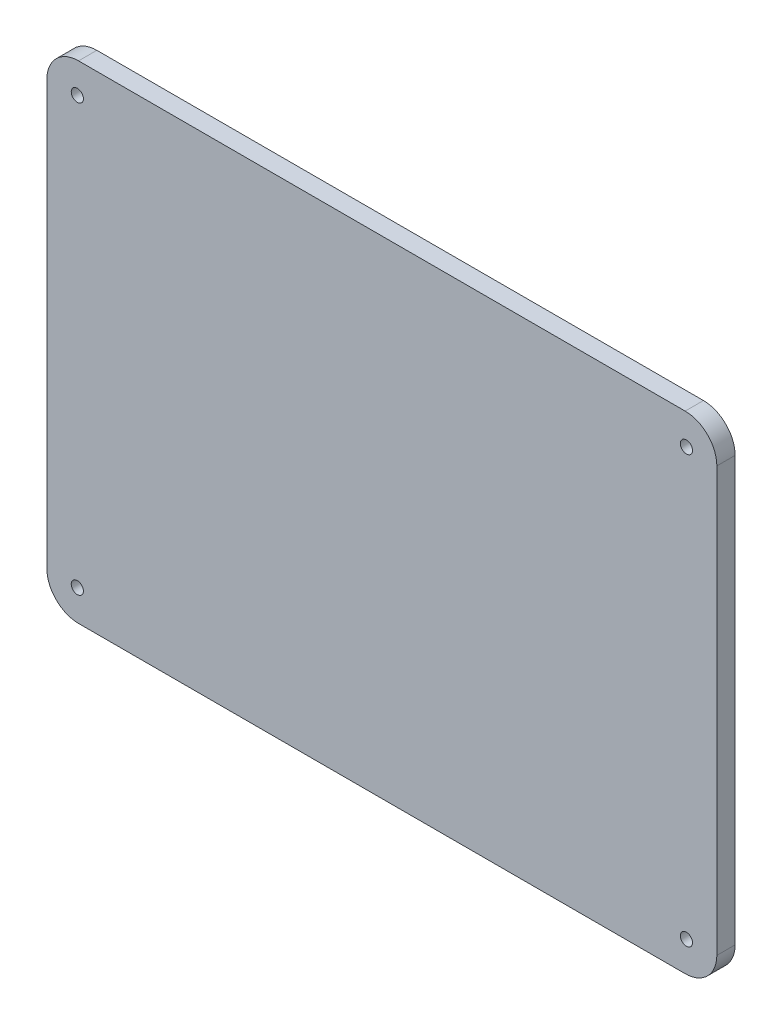
from build123d import *

# Parameters (mm, degrees)
BOSS_EXTRU_1_DEPTH = 3
PER_AGE1_OUTLINE_R = 1
PER_AGE1_DEPTH     = 3


# Read off the part's stored shape, not the designer's step: Perçage1
with BuildPart() as part:
    # Esquisse2 → Boss.-Extru.1 (new body)
    with BuildSketch(Plane.XY):
        with BuildLine():
            Line((-49.8, 40), (49.8, 40))
            ThreePointArc((49.8, 40), (53.476955262, 38.476955262), (55, 34.8))
            Line((55, 34.8), (55, -34.8))
            ThreePointArc((55, -34.8), (53.476955262, -38.476955262), (49.8, -40))
            Line((49.8, -40), (-49.8, -40))
            ThreePointArc((-49.8, -40), (-53.476955262, -38.476955262), (-55, -34.8))
            Line((-55, -34.8), (-55, 34.8))
            ThreePointArc((-55, 34.8), (-53.476955262, 38.476955262), (-49.8, 40))
        make_face()
    extrude(amount=BOSS_EXTRU_1_DEPTH)

    # Perçage1 outline → Perçage1 (cut)
    with BuildSketch(Plane.XY):
        with Locations((-50.004001665, 35.000001601)):
            Circle(PER_AGE1_OUTLINE_R)
        with Locations((-50.004001665, -35.000001601)):
            Circle(PER_AGE1_OUTLINE_R)
        with Locations((50.004001665, -35.000001601)):
            Circle(PER_AGE1_OUTLINE_R)
        with Locations((50.004001665, 35.000001601)):
            Circle(PER_AGE1_OUTLINE_R)
    extrude(amount=PER_AGE1_DEPTH, mode=Mode.SUBTRACT)


solid = part.part
